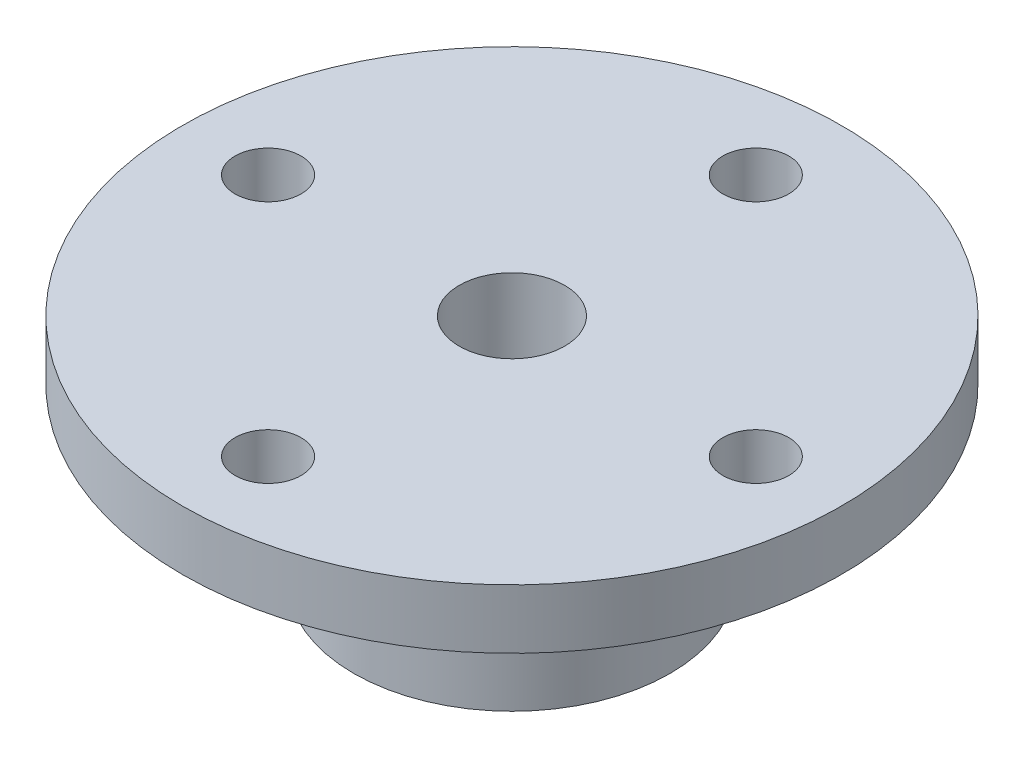
from build123d import *

# Parameters (mm, degrees)
SKETCH_1_R      = 12
SKETCH_1_R_2    = 4
EXTRUDE_1_DEPTH = 13
SKETCH_2_R      = 25
SKETCH_2_R_2    = 2.5
SKETCH_2_R_3    = 4
EXTRUDE_2_DEPTH = 4.5


with BuildPart() as part:
    # 草图1 → 凸台-拉伸1 (new body)
    with BuildSketch(Plane(origin=(0, 0, 0), x_dir=(1, 0, 0), z_dir=(0, 1, 0))):
        Circle(SKETCH_1_R)
        Circle(SKETCH_1_R_2, mode=Mode.SUBTRACT)
    extrude(amount=EXTRUDE_1_DEPTH)

    # 草图2 → 凸台-拉伸2 (add)
    with BuildSketch(Plane(origin=(0, 13, 0), x_dir=(1, 0, 0), z_dir=(0, 1, 0))):
        Circle(SKETCH_2_R)
        with Locations((0, 18.5)):
            Circle(SKETCH_2_R_2, mode=Mode.SUBTRACT)
        with Locations((-18.5, 0)):
            Circle(SKETCH_2_R_2, mode=Mode.SUBTRACT)
        with Locations((0, -18.5)):
            Circle(SKETCH_2_R_2, mode=Mode.SUBTRACT)
        with Locations((18.5, 0)):
            Circle(SKETCH_2_R_2, mode=Mode.SUBTRACT)
        Circle(SKETCH_2_R_3, mode=Mode.SUBTRACT)
    extrude(amount=EXTRUDE_2_DEPTH)


solid = part.part
